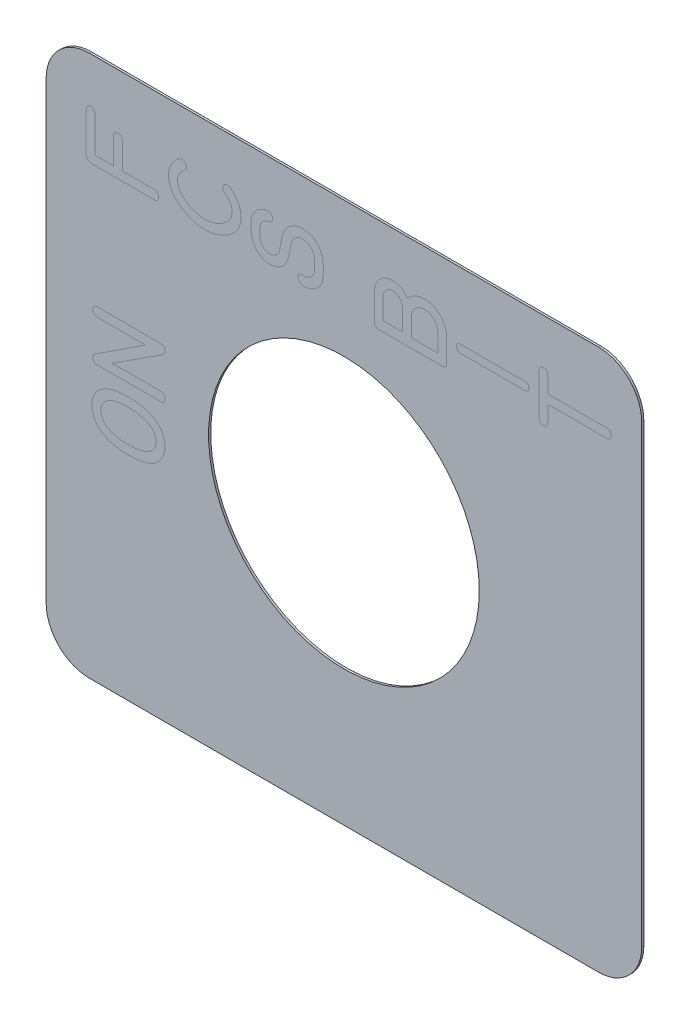
from build123d import *

# Parameters (mm, degrees)
SKETCH1_W           = 34.925
SKETCH1_H           = 31.75
SKETCH1_R           = 7.9375
BOSS_EXTRUDE1_DEPTH = 0.127
FILLET1_R           = 2.54


with BuildPart() as part:
    # Sketch1 → Boss-Extrude1 (new body)
    with BuildSketch(Plane.XY):
        with Locations((-2961.024368224, 6407.785)):
            Rectangle(SKETCH1_W, SKETCH1_H)
        with Locations((-2961.024368224, 6407.785)):
            Circle(SKETCH1_R, mode=Mode.SUBTRACT)
    extrude(amount=BOSS_EXTRUDE1_DEPTH)

    # Fillet1
    fillet1_edges = [part.edges().sort_by_distance(p)[0] for p in [
        (-2943.561868224, 6391.91, 0.0635),
        (-2943.561868224, 6423.66, 0.0635),
        (-2978.486868224, 6423.66, 0.0635),
        (-2978.486868224, 6391.91, 0.0635),
    ]]
    fillet(fillet1_edges, radius=FILLET1_R)


solid = part.part
